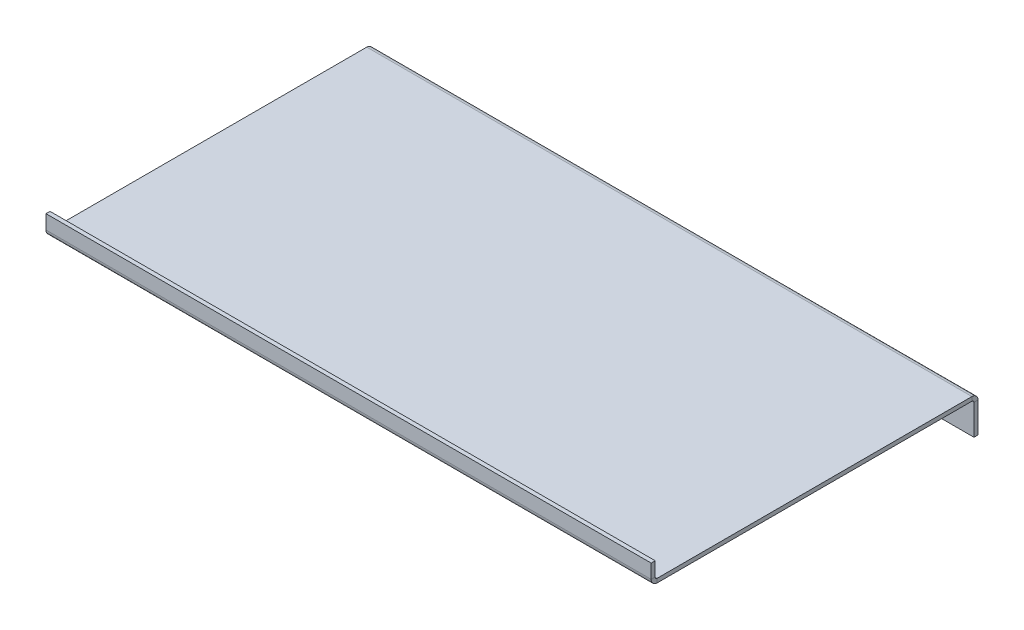
from build123d import *

# Parameters (mm, degrees)
BASE_FLANGE1_DEPTH = 150


# Sheet-metal steps are written as plain solids
with BuildPart() as part:
    # Sketch1 → Base-Flange1 (new body)
    with BuildSketch(Plane(origin=(0, 0, 0), x_dir=(0, 0, -1), z_dir=(1, 0, 0))):
        with BuildLine():
            Line((0, 0), (0, 7.5))
            ThreePointArc((0, 7.5), (-0.146446609, 7.853553391), (-0.5, 8))
            Line((-0.5, 8), (-78.5, 8))
            ThreePointArc((-78.5, 8), (-79.560660172, 8.439339828), (-80, 9.5))
            Line((-80, 9.5), (-80, 13))
            Line((-80, 13), (-79, 13))
            Line((-79, 13), (-79, 9.5))
            ThreePointArc((-79, 9.5), (-78.853553391, 9.146446609), (-78.5, 9))
            Line((-78.5, 9), (-0.5, 9))
            ThreePointArc((-0.5, 9), (0.560660172, 8.560660172), (1, 7.5))
            Line((1, 7.5), (1, 0))
            Line((1, 0), (0, 0))
        make_face()
    extrude(amount=BASE_FLANGE1_DEPTH)


solid = part.part
